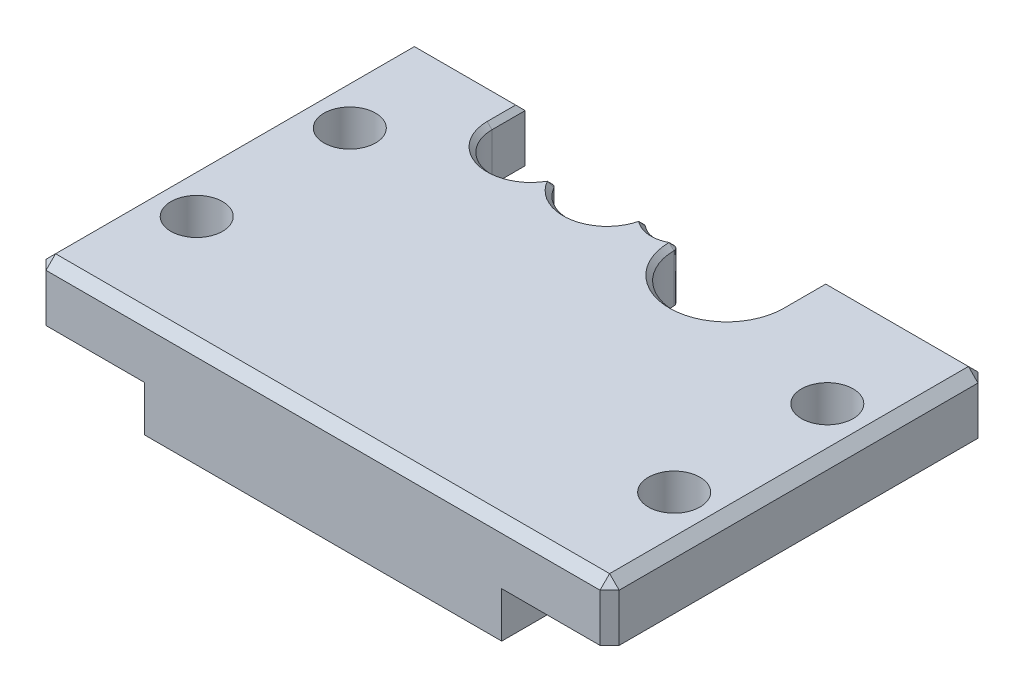
from build123d import *

# Parameters (mm, degrees)
SKETCH3_W           = 37.35
SKETCH3_H           = 6
BOSS_EXTRUDE1_DEPTH = 4.75
SKETCH4_W           = 59.9
SKETCH4_H           = 39.5
SKETCH4_R           = 2.7
BOSS_EXTRUDE2_DEPTH = 6
CUT_EXTRUDE1_REACH  = 52.723
CHAMFER1_SIZE       = 1
CHAMFER2_SIZE       = 0.5


with BuildPart() as part:
    # Sketch3 → Boss-Extrude1 (new body)
    with BuildSketch(Plane(origin=(0, 0, 0), x_dir=(1, 0, 0), z_dir=(0, 1, 0))):
        with Locations((0, 3)):
            Rectangle(SKETCH3_W, SKETCH3_H)
    extrude(amount=BOSS_EXTRUDE1_DEPTH)

    # Sketch4 → Boss-Extrude2 (add)
    with BuildSketch(Plane(origin=(0, 0, 0), x_dir=(1, 0, 0), z_dir=(0, 1, 0))):
        with Locations((0, 19.75)):
            Rectangle(SKETCH4_W, SKETCH4_H)
        with Locations(Location((-24.95, 11.75, 0), (0, 0, 270))):
            Circle(SKETCH4_R, mode=Mode.SUBTRACT)
        with Locations(Location((-24.95, 27.75, 0), (0, 0, 270))):
            Circle(SKETCH4_R, mode=Mode.SUBTRACT)
        with Locations(Location((24.95, 11.75, 0), (0, 0, 270))):
            Circle(SKETCH4_R, mode=Mode.SUBTRACT)
        with Locations(Location((24.95, 27.75, 0), (0, 0, 270))):
            Circle(SKETCH4_R, mode=Mode.SUBTRACT)
    extrude(amount=-BOSS_EXTRUDE2_DEPTH)

    # Sketch5 → Cut-Extrude1 (cut, up to next)
    with BuildSketch(Plane.XZ.offset(6), mode=Mode.PRIVATE) as cut_extrude1_sk1:
        with BuildLine():
            Line((-17.87, -35.525), (-17.87, -39.5))
            Line((-17.87, -39.5), (13.536249219, -39.5))
            Line((13.536249219, -39.5), (13.536249219, -34.125))
            ThreePointArc((13.536249219, -34.125), (8.084468405, -28.650049236), (2.586446162, -34.078562046))
            ThreePointArc((2.586446162, -34.078562046), (2.342198533, -34.503972069), (1.851800837, -34.515833459))
            ThreePointArc((1.851800837, -34.515833459), (0.335489147, -34.21151821), (-1.099084421, -34.789279052))
            ThreePointArc((-1.099084421, -34.789279052), (-1.570217122, -34.872337403), (-1.895484475, -34.521529961))
            ThreePointArc((-1.895484475, -34.521529961), (-5.298347165, -31.486832634), (-9.38557377, -33.507585225))
            ThreePointArc((-9.38557377, -33.507585225), (-9.82, -33.760049669), (-10.25442623, -33.507585225))
            ThreePointArc((-10.25442623, -33.507585225), (-14.838500571, -31.585871726), (-17.87, -35.525))
        make_face()
    cut_extrude1_tool1 = extrude(cut_extrude1_sk1.sketch, amount=-CUT_EXTRUDE1_REACH, mode=Mode.PRIVATE) & part.part
    add(cut_extrude1_tool1.solids().sort_by_distance((-1.140343, -6, -35.39747))[0], mode=Mode.SUBTRACT)

    # Chamfer1
    chamfer1_edges = [part.edges().sort_by_distance(p)[0] for p in [
        (-29.95, -6, -19.75),
        (-29.95, -3, 0),
        (21.74312461, -6, -39.5),
        (-29.95, -3, -39.5),
        (29.95, -6, -19.75),
        (29.95, -3, -39.5),
        (0, -6, 0),
        (29.95, -3, 0),
        (-23.91, -6, -39.5),
    ]]
    chamfer(chamfer1_edges, length=CHAMFER1_SIZE)

    # Chamfer2
    chamfer2_edges = [part.edges().sort_by_distance(p)[0] for p in [
        (13.536249219, 0, -36.8125),
        (8.084468405, 0, -28.650049236),
        (2.342198533, 0, -34.503972069),
        (0.335489147, 0, -34.21151821),
        (-1.570217122, 0, -34.872337403),
        (-5.298347165, 0, -31.486832634),
        (-9.82, 0, -33.760049669),
        (-14.838500571, 0, -31.585871726),
        (-17.87, 0, -37.5125),
        (13.536249219, -6, -36.3125),
        (8.084468405, -6, -28.650049236),
        (2.342198533, -6, -34.503972069),
        (0.335489147, -6, -34.21151821),
        (-1.570217122, -6, -34.872337403),
        (-5.298347165, -6, -31.486832634),
        (-9.82, -6, -33.760049669),
        (-14.838500571, -6, -31.585871726),
        (-17.87, -6, -37.0125),
        (13.536249219, -2.5, -39.5),
        (-17.87, -2.5, -39.5),
    ]]
    chamfer(chamfer2_edges, length=CHAMFER2_SIZE - 0.0001)  # a hair under: the kernel refuses the full size


with BuildPart() as body_2:
    # Mirror1: mirrored copy
    add(part.part.mirror(Plane(origin=(0, -6, 0), x_dir=(0, 0, 1), z_dir=(0, -1, 0))))


solid = body_2.part
